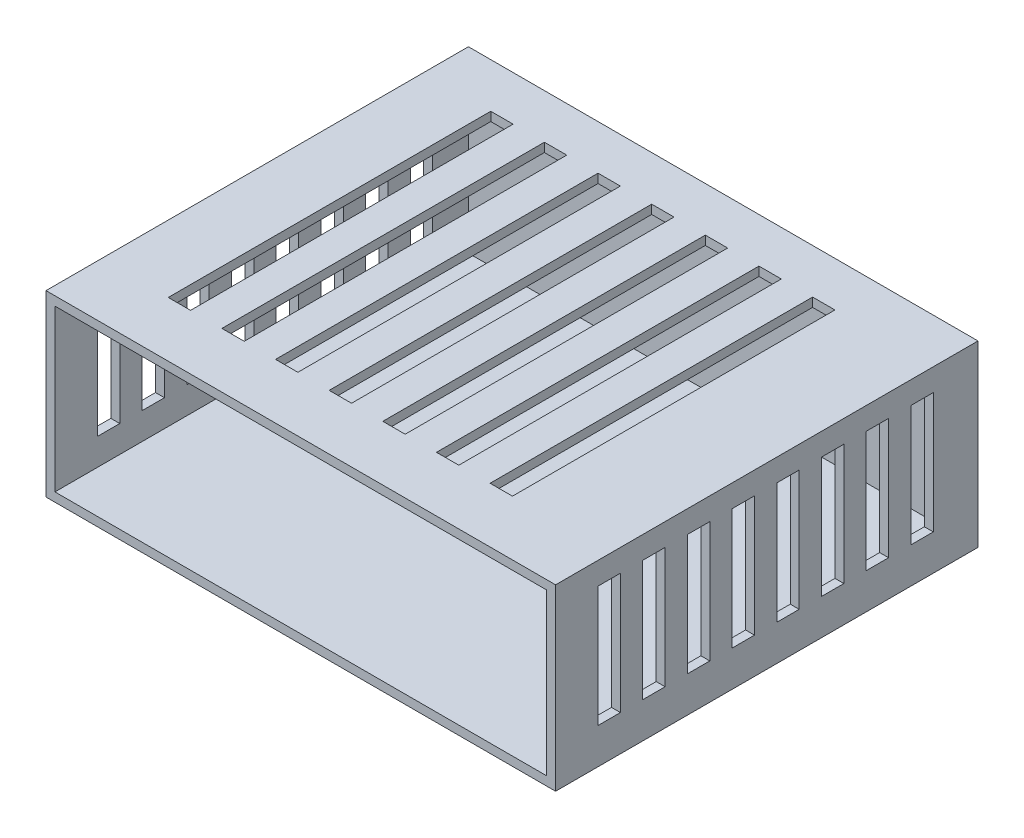
from build123d import *

# Parameters (mm, degrees)
SKETCH_1_W          = 114
SKETCH_1_H          = 94.5
EXTRUDE_1_DEPTH     = 40
SHELL_1_T           = -2
SKETCH_2_W          = 5
SKETCH_2_H          = 72.15042502
CUT_EXTRUDE_3_DEPTH = 20
SKETCH_6_W          = 5
SKETCH_6_H          = 27
CUT_EXTRUDE_4_DEPTH = 1000


with BuildPart() as part:
    # 草图1 → 凸台-拉伸1 (new body)
    with BuildSketch(Plane(origin=(0, 0, 0), x_dir=(1, 0, 0), z_dir=(0, 1, 0))):
        with Locations((57, 47.25)):
            Rectangle(SKETCH_1_W, SKETCH_1_H)
    extrude(amount=EXTRUDE_1_DEPTH)

    # 抽壳1
    shell_1_openings = [part.faces().sort_by_distance(p)[0] for p in [
        (57, 20, 0),
    ]]
    offset(amount=SHELL_1_T, openings=shell_1_openings, kind=Kind.INTERSECTION)

    # 草图2 → 切除-拉伸3 (cut)
    with BuildSketch(Plane(origin=(0, 40, 0), x_dir=(1, 0, 0), z_dir=(0, 1, 0))):
        with Locations((17.5, 48.42478749)):
            Rectangle(SKETCH_2_W, SKETCH_2_H)
        with Locations((29.5, 48.42478749)):
            Rectangle(SKETCH_2_W, SKETCH_2_H)
        with Locations((41.5, 48.42478749)):
            Rectangle(SKETCH_2_W, SKETCH_2_H)
        with Locations((53.5, 48.42478749)):
            Rectangle(SKETCH_2_W, SKETCH_2_H)
        with Locations((65.5, 48.42478749)):
            Rectangle(SKETCH_2_W, SKETCH_2_H)
        with Locations((77.5, 48.42478749)):
            Rectangle(SKETCH_2_W, SKETCH_2_H)
        with Locations((89.5, 48.42478749)):
            Rectangle(SKETCH_2_W, SKETCH_2_H)
    extrude(amount=-CUT_EXTRUDE_3_DEPTH, mode=Mode.SUBTRACT)

    # 草图6 → 切除-拉伸4 (cut)
    with BuildSketch(Plane.ZY):
        with Locations((-72, 21.5)):
            Rectangle(SKETCH_6_W, SKETCH_6_H)
        with Locations((-82, 21.5)):
            Rectangle(SKETCH_6_W, SKETCH_6_H)
        with Locations((-62, 21.5)):
            Rectangle(SKETCH_6_W, SKETCH_6_H)
        with Locations((-52, 21.5)):
            Rectangle(SKETCH_6_W, SKETCH_6_H)
        with Locations((-42, 21.5)):
            Rectangle(SKETCH_6_W, SKETCH_6_H)
        with Locations((-32, 21.5)):
            Rectangle(SKETCH_6_W, SKETCH_6_H)
        with Locations((-22, 21.5)):
            Rectangle(SKETCH_6_W, SKETCH_6_H)
        with Locations((-12, 21.5)):
            Rectangle(SKETCH_6_W, SKETCH_6_H)
    extrude(amount=-CUT_EXTRUDE_4_DEPTH, mode=Mode.SUBTRACT)


solid = part.part
